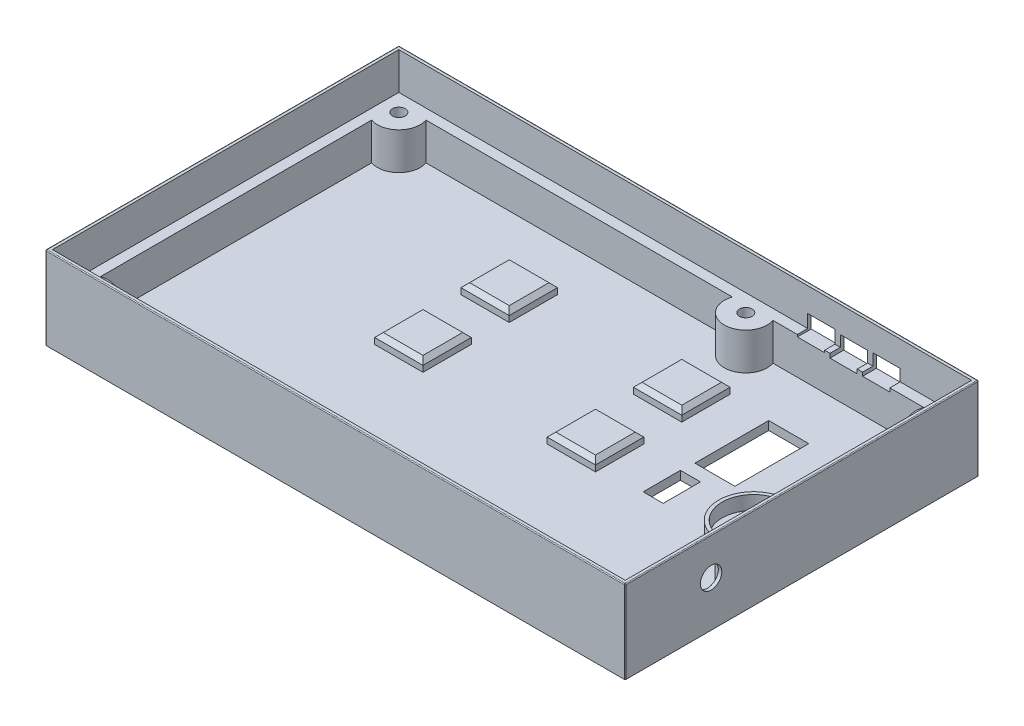
from build123d import *

# Parameters (mm, degrees)
BASESKETCH1_W                               = 168
BASESKETCH1_H                               = 102.4
BASESKETCH1_R                               = 2
BASESKETCH1_R_2                             = 1.85
BASESKETCH1_W_2                             = 11.6
BASESKETCH1_H_2                             = 21.4
BASESKETCH1_W_3                             = 5.8
BASESKETCH1_H_3                             = 10.8
BASEBOSS_EXTRUDE1_DEPTH                     = 2.5
SKETCH2_W                                   = 168
SKETCH2_H                                   = 102.4
SKETCH2_W_2                                 = 160
SKETCH2_H_2                                 = 94.4
WALLBOSS_EXTRUDE2_DEPTH                     = 21.5
SKETCH3_W                                   = 14
SKETCH3_H                                   = 14
MOUNTHOLEBOSS_EXTRUDE3_DEPTH                = 3
MOUNTHOLEBOSSCHAMFER3_SIZE                  = 1.25
HDMI7MOUNTHOLESSKETCH8_R                    = 1.85
HDMI7MOUNTHOLESBOSS_EXTRUDE4_DEPTH          = 10.75
DISPLAYBUTTONSCUT_EXTRUDE1_REACH            = 200.206
DISPLAYBUTTONSSKETCH9_W                     = 7.9
DISPLAYBUTTONSSKETCH9_H                     = 4.4
AUDIOCONNECTORCUT_EXTRUDE2_REACH            = 200.206
AUDIOCONNECTORSKETCH10_R                    = 3.1
M3BORESKETCH11_R                            = 2.85
M3BORECUT_EXTRUDE3_DEPTH                    = 3
UPPERTHINWALLSKETCH4_W                      = 166
UPPERTHINWALLSKETCH4_H                      = 100.4
UPPERTHINWALLSKETCH4_W_2                    = 160
UPPERTHINWALLSKETCH4_H_2                    = 94.4
UPPERTHINWALLCUT_EXTRUDE1_DEPTH             = 10.75
HDMI7AUDIOCONNECTORKNOTCHSKETCH5_W          = 3
HDMI7AUDIOCONNECTORKNOTCHSKETCH5_H          = 10.199193496
HDMI7AUDIOCONNECTORKNOTCHCUT_EXTRUDE2_DEPTH = 8.2
TOPFILLET1_R                                = 0.25
CORNERFILLET2_R                             = 0.25
SPEAKERHOLESKETCH4_R                        = 6.75
SPEAERHOLECUT_EXTRUDE1_DEPTH                = 198.919200686
SPEAKERHOLDERSKETCH5_R                      = 10.1
SPEAKERHOLDERSKETCH5_R_2                    = 9.1
SPEAKERHOLDERBOSS_EXTRUDE1_DEPTH            = 4


with BuildPart() as part:
    # BaseSketch1 → BaseBoss-Extrude1 (new body)
    with BuildSketch(Plane(origin=(0, 0, 0), x_dir=(1, 0, 0), z_dir=(0, 1, 0))):
        with Locations((84, 51.2)):
            Rectangle(BASESKETCH1_W, BASESKETCH1_H)
        with Locations(Location((57, 77.4, 0), (0, 0, 270))):
            Circle(BASESKETCH1_R, mode=Mode.SUBTRACT)
        with Locations(Location((107, 77.4, 0), (0, 0, 270))):
            Circle(BASESKETCH1_R, mode=Mode.SUBTRACT)
        with Locations(Location((57, 52.4, 0), (0, 0, 270))):
            Circle(BASESKETCH1_R, mode=Mode.SUBTRACT)
        with Locations(Location((107, 52.4, 0), (0, 0, 270))):
            Circle(BASESKETCH1_R, mode=Mode.SUBTRACT)
        with Locations(Location((6, 96.4, 0), (0, 0, 270))):
            Circle(BASESKETCH1_R_2, mode=Mode.SUBTRACT)
        with Locations(Location((6, 6, 0), (0, 0, 270))):
            Circle(BASESKETCH1_R_2, mode=Mode.SUBTRACT)
        with Locations(Location((162, 6, 0), (0, 0, 270))):
            Circle(BASESKETCH1_R_2, mode=Mode.SUBTRACT)
        with Locations(Location((162, 96.4, 0), (0, 0, 270))):
            Circle(BASESKETCH1_R_2, mode=Mode.SUBTRACT)
        with Locations(Location((106.55, 96.4, 0), (0, 0, 270))):
            Circle(BASESKETCH1_R_2, mode=Mode.SUBTRACT)
        with Locations((132, 72.7)):
            Rectangle(BASESKETCH1_W_2, BASESKETCH1_H_2, mode=Mode.SUBTRACT)
        with Locations((128.8, 52.71)):
            Rectangle(BASESKETCH1_W_3, BASESKETCH1_H_3, mode=Mode.SUBTRACT)
    extrude(amount=BASEBOSS_EXTRUDE1_DEPTH)

    # Sketch2 → WallBoss-Extrude2 (add)
    with BuildSketch(Plane(origin=(0, 2.5, 0), x_dir=(1, 0, 0), z_dir=(0, 1, 0))):
        with Locations((84, 51.2)):
            Rectangle(SKETCH2_W, SKETCH2_H)
        with Locations((84, 51.2)):
            Rectangle(SKETCH2_W_2, SKETCH2_H_2, mode=Mode.SUBTRACT)
    extrude(amount=WALLBOSS_EXTRUDE2_DEPTH)

    # Sketch3 → MountHoleBoss-Extrude3 (add)
    with BuildSketch(Plane(origin=(0, 2.5, 0), x_dir=(1, 0, 0), z_dir=(0, 1, 0))):
        with Locations((57, 77.4)):
            Rectangle(SKETCH3_W, SKETCH3_H)
        with Locations((57, 52.4)):
            Rectangle(SKETCH3_W, SKETCH3_H)
        with Locations((107, 77.4)):
            Rectangle(SKETCH3_W, SKETCH3_H)
        with Locations((107, 52.4)):
            Rectangle(SKETCH3_W, SKETCH3_H)
    extrude(amount=MOUNTHOLEBOSS_EXTRUDE3_DEPTH)

    # MountHoleBossChamfer3
    mountholebosschamfer3_edges = [part.edges().sort_by_distance(p)[0] for p in [
        (64, 5.5, -77.4),
        (57, 5.5, -84.4),
        (50, 5.5, -77.4),
        (57, 5.5, -70.4),
        (64, 5.5, -52.4),
        (57, 5.5, -59.4),
        (50, 5.5, -52.4),
        (57, 5.5, -45.4),
        (114, 5.5, -77.4),
        (107, 5.5, -84.4),
        (100, 5.5, -77.4),
        (107, 5.5, -70.4),
        (114, 5.5, -52.4),
        (107, 5.5, -59.4),
        (100, 5.5, -52.4),
        (107, 5.5, -45.4),
    ]]
    chamfer(mountholebosschamfer3_edges, length=MOUNTHOLEBOSSCHAMFER3_SIZE)

    # HDMI7MountHolesSketch8 → HDMI7MountHolesBoss-Extrude4 (add)
    # profile 1 of 5: a face of its own
    with BuildSketch(Plane(origin=(0, 2.5, 0), x_dir=(1, 0, 0), z_dir=(0, 1, 0))):
        with BuildLine():
            Line((4, 90.524299493), (4, 98.4))
            Line((4, 98.4), (11.875700507, 98.4))
            ThreePointArc((11.875700507, 98.4), (10.388841331, 92.011158669), (4, 90.524299493))
        make_face()
        with Locations(Location((6, 96.4, 0), (0, 0, 270))):
            Circle(HDMI7MOUNTHOLESSKETCH8_R, mode=Mode.SUBTRACT)
    # profile 2 of 5: a face of its own
    with BuildSketch(Plane(origin=(0, 2.5, 0), x_dir=(1, 0, 0), z_dir=(0, 1, 0))):
        with BuildLine():
            Line((156.124299493, 98.4), (164, 98.4))
            Line((164, 98.4), (164, 90.524299493))
            ThreePointArc((164, 90.524299493), (157.611158669, 92.011158669), (156.124299493, 98.4))
        make_face()
        with Locations(Location((162, 96.4, 0), (0, 0, 270))):
            Circle(HDMI7MOUNTHOLESSKETCH8_R, mode=Mode.SUBTRACT)
    # profile 3 of 5: a face of its own
    with BuildSketch(Plane(origin=(0, 2.5, 0), x_dir=(1, 0, 0), z_dir=(0, 1, 0))):
        with BuildLine():
            Line((156.124299493, 4), (164, 4))
            Line((164, 4), (164, 11.875700507))
            ThreePointArc((164, 11.875700507), (157.611158669, 10.388841331), (156.124299493, 4))
        make_face()
        with Locations(Location((162, 6, 0), (0, 0, 270))):
            Circle(HDMI7MOUNTHOLESSKETCH8_R, mode=Mode.SUBTRACT)
    # profile 4 of 5: a face of its own
    with BuildSketch(Plane(origin=(0, 2.5, 0), x_dir=(1, 0, 0), z_dir=(0, 1, 0))):
        with BuildLine():
            Line((11.875700507, 4), (4, 4))
            Line((4, 4), (4, 11.875700507))
            ThreePointArc((4, 11.875700507), (10.388841331, 10.388841331), (11.875700507, 4))
        make_face()
        with Locations(Location((6, 6, 0), (0, 0, 270))):
            Circle(HDMI7MOUNTHOLESSKETCH8_R, mode=Mode.SUBTRACT)
    # profile 5 of 5: a face of its own
    with BuildSketch(Plane(origin=(0, 2.5, 0), x_dir=(1, 0, 0), z_dir=(0, 1, 0))):
        with BuildLine():
            Line((100.674299493, 98.4), (112.425700507, 98.4))
            ThreePointArc((112.425700507, 98.4), (106.55, 90.193241067), (100.674299493, 98.4))
        make_face()
        with Locations(Location((106.55, 96.4, 0), (0, 0, 270))):
            Circle(HDMI7MOUNTHOLESSKETCH8_R, mode=Mode.SUBTRACT)
    extrude(amount=HDMI7MOUNTHOLESBOSS_EXTRUDE4_DEPTH)

    # DisplayButtonsSketch9 → DisplayButtonsCut-Extrude1 (cut, up to next)
    with BuildSketch(Plane(origin=(0, 0, -102.4), x_dir=(-1, 0, 0), z_dir=(0, 0, -1)), mode=Mode.PRIVATE) as displaybuttonscut_extrude1_sk1:
        with Locations((-142.35, 14.41)):
            Rectangle(DISPLAYBUTTONSSKETCH9_W, DISPLAYBUTTONSSKETCH9_H)
    displaybuttonscut_extrude1_tool1 = extrude(displaybuttonscut_extrude1_sk1.sketch, amount=-DISPLAYBUTTONSCUT_EXTRUDE1_REACH, mode=Mode.PRIVATE) & part.part
    # DisplayButtonsSketch9 → DisplayButtonsCut-Extrude1 (cut, up to next)
    with BuildSketch(Plane(origin=(0, 0, -102.4), x_dir=(-1, 0, 0), z_dir=(0, 0, -1)), mode=Mode.PRIVATE) as displaybuttonscut_extrude1_sk2:
        with Locations((-132.9, 14.243897474)):
            Rectangle(DISPLAYBUTTONSSKETCH9_W, DISPLAYBUTTONSSKETCH9_H)
    displaybuttonscut_extrude1_tool2 = extrude(displaybuttonscut_extrude1_sk2.sketch, amount=-DISPLAYBUTTONSCUT_EXTRUDE1_REACH, mode=Mode.PRIVATE) & part.part
    # DisplayButtonsSketch9 → DisplayButtonsCut-Extrude1 (cut, up to next)
    with BuildSketch(Plane(origin=(0, 0, -102.4), x_dir=(-1, 0, 0), z_dir=(0, 0, -1)), mode=Mode.PRIVATE) as displaybuttonscut_extrude1_sk3:
        with Locations((-123.45, 14.823897474)):
            Rectangle(DISPLAYBUTTONSSKETCH9_W, DISPLAYBUTTONSSKETCH9_H)
    displaybuttonscut_extrude1_tool3 = extrude(displaybuttonscut_extrude1_sk3.sketch, amount=-DISPLAYBUTTONSCUT_EXTRUDE1_REACH, mode=Mode.PRIVATE) & part.part
    add(displaybuttonscut_extrude1_tool1.solids().sort_by_distance((142.35, 14.41, -102.4))[0], mode=Mode.SUBTRACT)
    add(displaybuttonscut_extrude1_tool2.solids().sort_by_distance((132.9, 14.243897, -102.4))[0], mode=Mode.SUBTRACT)
    add(displaybuttonscut_extrude1_tool3.solids().sort_by_distance((123.45, 14.823897, -102.4))[0], mode=Mode.SUBTRACT)

    # AudioConnectorSketch10 → AudioConnectorCut-Extrude2 (cut, up to next)
    with BuildSketch(Plane(origin=(168, 0, 0), x_dir=(0, 0, -1), z_dir=(1, 0, 0)), mode=Mode.PRIVATE) as audioconnectorcut_extrude2_sk1:
        with Locations((24.9, 13.2)):
            Circle(AUDIOCONNECTORSKETCH10_R)
    audioconnectorcut_extrude2_tool1 = extrude(audioconnectorcut_extrude2_sk1.sketch, amount=-AUDIOCONNECTORCUT_EXTRUDE2_REACH, mode=Mode.PRIVATE) & part.part
    add(audioconnectorcut_extrude2_tool1.solids().sort_by_distance((168, 13.2, -24.9))[0], mode=Mode.SUBTRACT)

    # M3BoreSketch11 → M3BoreCut-Extrude3 (cut)
    with BuildSketch(Plane.XZ):
        with Locations(Location((6, -6, 0), (0, 0, 270))):
            Circle(M3BORESKETCH11_R)
        with Locations(Location((162, -6, 0), (0, 0, 270))):
            Circle(M3BORESKETCH11_R)
        with Locations(Location((162, -96.4, 0), (0, 0, 270))):
            Circle(M3BORESKETCH11_R)
        with Locations(Location((6, -96.4, 0), (0, 0, 270))):
            Circle(M3BORESKETCH11_R)
        with Locations(Location((106.55, -96.4, 0), (0, 0, 270))):
            Circle(M3BORESKETCH11_R)
    extrude(amount=-M3BORECUT_EXTRUDE3_DEPTH, mode=Mode.SUBTRACT)

    # UpperThinWallSketch4 → UpperThinWallCut-Extrude1 (cut)
    with BuildSketch(Plane(origin=(0, 24, 0), x_dir=(1, 0, 0), z_dir=(0, 1, 0))):
        with Locations((84, 51.2)):
            Rectangle(UPPERTHINWALLSKETCH4_W, UPPERTHINWALLSKETCH4_H)
        with Locations((84, 51.2)):
            Rectangle(UPPERTHINWALLSKETCH4_W_2, UPPERTHINWALLSKETCH4_H_2, mode=Mode.SUBTRACT)
    extrude(amount=-UPPERTHINWALLCUT_EXTRUDE1_DEPTH, mode=Mode.SUBTRACT)

    # HDMI7AudioConnectorKnotchSketch5 → HDMI7AudioConnectorKnotchCut-Extrude2 (cut)
    with BuildSketch(Plane(origin=(0, 13.25, 0), x_dir=(1, 0, 0), z_dir=(0, 1, 0))):
        with Locations((165.5, 24.9)):
            Rectangle(HDMI7AUDIOCONNECTORKNOTCHSKETCH5_W, HDMI7AUDIOCONNECTORKNOTCHSKETCH5_H)
    extrude(amount=-HDMI7AUDIOCONNECTORKNOTCHCUT_EXTRUDE2_DEPTH, mode=Mode.SUBTRACT)

    # TopFillet1
    topfillet1_edges = [part.edges().sort_by_distance(p)[0] for p in [
        (0, 24, -51.2),
        (84, 24, 0),
        (168, 24, -51.2),
        (84, 24, -102.4),
    ]]
    fillet(topfillet1_edges, radius=TOPFILLET1_R)

    # CornerFillet2
    # the kernel refuses this fillet: 0.25 mm, written as the material it takes off along each edge
    with BuildSketch(Plane(origin=(0.25, 23.75, -0.25), x_dir=(0, 0, 1), z_dir=(-1, 0, 0))) as cornerfillet2_piece_1_section:
        Polygon((0, 0), (CORNERFILLET2_R, 0), (CORNERFILLET2_R, CORNERFILLET2_R), (0, CORNERFILLET2_R), align=None)
    cornerfillet2_piece_1 = extrude(amount=CORNERFILLET2_R, mode=Mode.PRIVATE)
    cornerfillet2_piece_1 = cornerfillet2_piece_1 - Plane(origin=(0.25, 23.75, -0.25), x_dir=(0, -0.7071067811865475, -0.7071067811865475), z_dir=(-1, 0, 0)) * Sphere(CORNERFILLET2_R, mode=Mode.PRIVATE)
    add(cornerfillet2_piece_1, mode=Mode.SUBTRACT)
    with BuildSketch(Plane(origin=(0.25, 23.75, -102.15), x_dir=(0, 0, -1), z_dir=(-1, 0, 0))) as cornerfillet2_piece_2_section:
        Polygon((0, 0), (CORNERFILLET2_R, 0), (CORNERFILLET2_R, -CORNERFILLET2_R), (0, -CORNERFILLET2_R), align=None)
    cornerfillet2_piece_2 = extrude(amount=CORNERFILLET2_R, mode=Mode.PRIVATE)
    cornerfillet2_piece_2 = cornerfillet2_piece_2 - Plane(origin=(0.25, 23.75, -102.15), x_dir=(0, -0.7071067811865475, 0.7071067811865475), z_dir=(-1, 0, 0)) * Sphere(CORNERFILLET2_R, mode=Mode.PRIVATE)
    add(cornerfillet2_piece_2, mode=Mode.SUBTRACT)
    with BuildSketch(Plane(origin=(167.75, 23.75, -0.25), x_dir=(1, 0, 0), z_dir=(0, 0, 1))) as cornerfillet2_piece_3_section:
        Polygon((0, 0), (CORNERFILLET2_R, 0), (CORNERFILLET2_R, CORNERFILLET2_R), (0, CORNERFILLET2_R), align=None)
    cornerfillet2_piece_3 = extrude(amount=CORNERFILLET2_R, mode=Mode.PRIVATE)
    cornerfillet2_piece_3 = cornerfillet2_piece_3 - Plane(origin=(167.75, 23.75, -0.25), x_dir=(-0.7071067811865475, -0.7071067811865475, 0), z_dir=(0, 0, 1)) * Sphere(CORNERFILLET2_R, mode=Mode.PRIVATE)
    add(cornerfillet2_piece_3, mode=Mode.SUBTRACT)
    with BuildSketch(Plane(origin=(167.75, 23.75, -102.15), x_dir=(1, 0, 0), z_dir=(0, 0, -1))) as cornerfillet2_piece_4_section:
        Polygon((0, 0), (CORNERFILLET2_R, 0), (CORNERFILLET2_R, -CORNERFILLET2_R), (0, -CORNERFILLET2_R), align=None)
    cornerfillet2_piece_4 = extrude(amount=CORNERFILLET2_R, mode=Mode.PRIVATE)
    cornerfillet2_piece_4 = cornerfillet2_piece_4 - Plane(origin=(167.75, 23.75, -102.15), x_dir=(-0.7071067811865475, -0.7071067811865475, 0), z_dir=(0, 0, -1)) * Sphere(CORNERFILLET2_R, mode=Mode.PRIVATE)
    add(cornerfillet2_piece_4, mode=Mode.SUBTRACT)
    with BuildSketch(Plane(origin=(168, -0.625, -102.4), x_dir=(-1, 0, 0), z_dir=(0, 1, 0)), Plane(origin=(0, 23.75, 0), x_dir=(0, 0, -1), z_dir=(0, -1, 0))) as cornerfillet2_piece_5:
        with BuildLine():
            CenterArc((CORNERFILLET2_R, CORNERFILLET2_R), CORNERFILLET2_R, 180, 90)
            Line((0, CORNERFILLET2_R), (0, 0))
            Line((0, 0), (CORNERFILLET2_R, 0))
        make_face()
    extrude(amount=24.375, mode=Mode.SUBTRACT)
    with BuildSketch(Plane(origin=(168, -0.625, 0), x_dir=(-1, 0, 0), z_dir=(0, 1, 0)), Plane(origin=(0, 23.75, -102.4), x_dir=(0, 0, 1), z_dir=(0, -1, 0))) as cornerfillet2_piece_6:
        with BuildLine():
            CenterArc((CORNERFILLET2_R, -CORNERFILLET2_R), CORNERFILLET2_R, 90, 90)
            Line((0, -CORNERFILLET2_R), (0, 0))
            Line((0, 0), (CORNERFILLET2_R, 0))
        make_face()
    extrude(amount=24.375, mode=Mode.SUBTRACT)

    # SpeakerHoleSketch4 → SpeaerHoleCut-Extrude1 (cut, through all)
    with BuildSketch(Plane(origin=(0, 2.5, 0), x_dir=(1, 0, 0), z_dir=(0, 1, 0))):
        with Locations(Location((153, 52.2, 0), (0, 0, 270))):
            Circle(SPEAKERHOLESKETCH4_R)
    extrude(amount=-SPEAERHOLECUT_EXTRUDE1_DEPTH, mode=Mode.SUBTRACT)

    # SpeakerHolderSketch5 → SpeakerHolderBoss-Extrude1 (add)
    with BuildSketch(Plane(origin=(0, 2.5, 0), x_dir=(1, 0, 0), z_dir=(0, 1, 0))):
        with Locations(Location((153, 52.2, 0), (0, 0, 90))):
            Circle(SPEAKERHOLDERSKETCH5_R)
        with Locations(Location((153, 52.2, 0), (0, 0, 270))):
            Circle(SPEAKERHOLDERSKETCH5_R_2, mode=Mode.SUBTRACT)
    extrude(amount=SPEAKERHOLDERBOSS_EXTRUDE1_DEPTH)


solid = part.part
